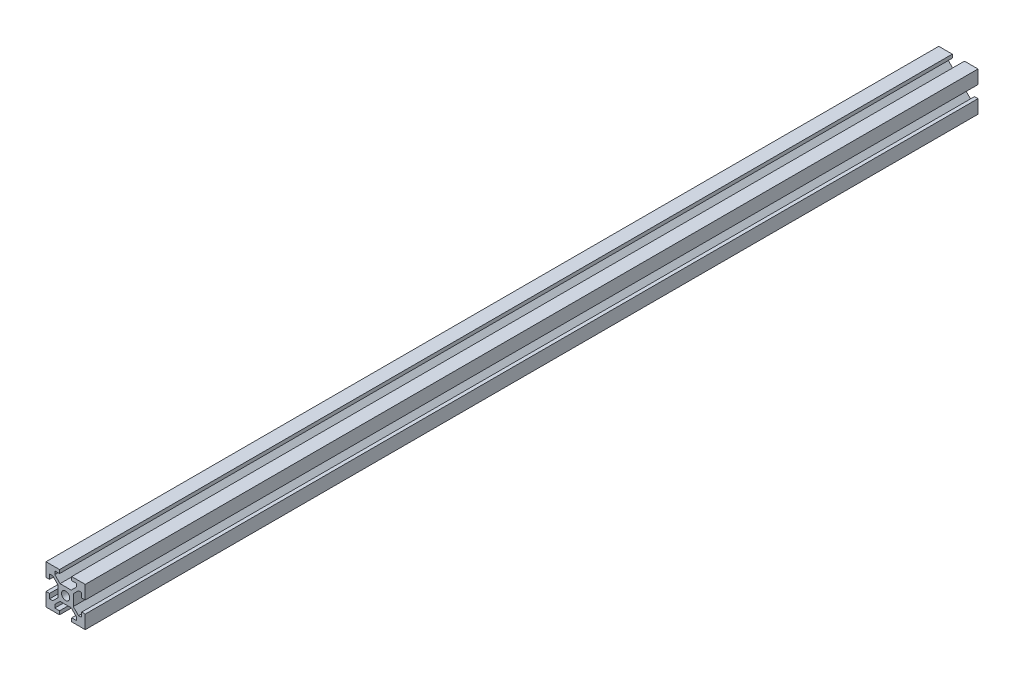
from build123d import *

# Parameters (mm, degrees)
BOSS_EXTRUDE1_DEPTH = 454.97
SKETCH2_R           = 2.1
CUT_EXTRUDE1_DEPTH  = 456.189741646
SKETCH3_R           = 2.1
CUT_EXTRUDE2_DEPTH  = 456.292136164


with BuildPart() as part:
    # Sketch1 → Boss-Extrude1 (new body)
    with BuildSketch(Plane.XY):
        Polygon((-3.1, 10), (-3.1, 8.200660172), (-5.5, 8.200660172), (-5.5, 6.560660172), (-2.84, 3.900660172), (2.84, 3.900660172), (5.5, 6.560660172), (5.5, 8.200660172), (3.1, 8.200660172), (3.1, 10), (10, 10), (10, 3.1), (8.200660172, 3.1), (8.200660172, 5.5), (6.560660172, 5.5), (3.900660172, 2.84), (3.900660172, -2.84), (6.560660172, -5.5), (8.200660172, -5.5), (8.200660172, -3.1), (10, -3.1), (10, -10), (3.1, -10), (3.1, -8.200660172), (5.5, -8.200660172), (5.5, -6.560660172), (2.84, -3.900660172), (-2.84, -3.900660172), (-5.5, -6.560660172), (-5.5, -8.200660172), (-3.1, -8.200660172), (-3.1, -10), (-10, -10), (-10, -3.1), (-8.200660172, -3.1), (-8.200660172, -5.5), (-6.560660172, -5.5), (-3.900660172, -2.84), (-3.900660172, 2.84), (-6.560660172, 5.5), (-8.200660172, 5.5), (-8.200660172, 3.1), (-10, 3.1), (-10, 10), align=None)
    extrude(amount=BOSS_EXTRUDE1_DEPTH)

    # Sketch2 → Cut-Extrude1 (cut, through all)
    with BuildSketch(Plane.XY.offset(454.97)):
        Circle(SKETCH2_R)
    extrude(amount=-CUT_EXTRUDE1_DEPTH, mode=Mode.SUBTRACT)

    # Sketch3 → Cut-Extrude2 (cut, through all)
    with BuildSketch(Plane(origin=(0, 3.900660172, 0), x_dir=(1, 0, 0), z_dir=(0, 1, 0))):
        with Locations((0, -227.485)):
            Circle(SKETCH3_R)
    extrude(amount=-CUT_EXTRUDE2_DEPTH, mode=Mode.SUBTRACT)


solid = part.part
